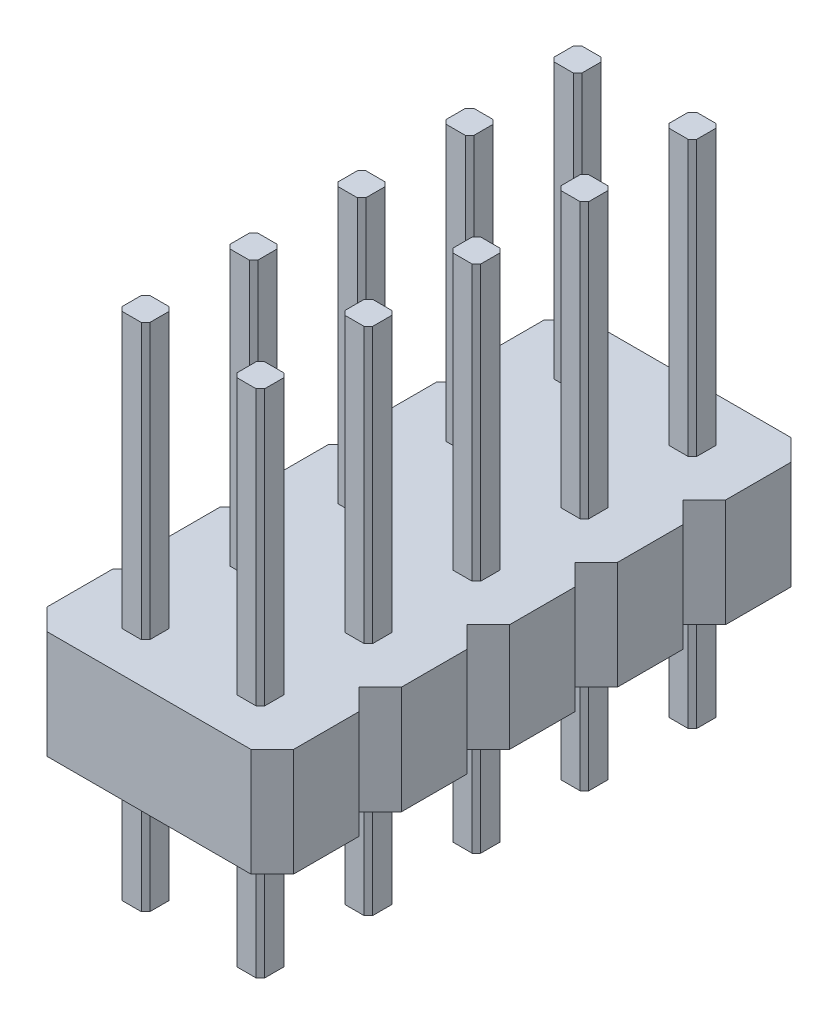
from build123d import *

# Parameters (mm, degrees)
BOSS_EXTRUDE2_DEPTH   = 12
BOSS_EXTRUDE2_2_DEPTH = 12
BOSS_EXTRUDE3_DEPTH   = 2.54
LPATTERN1_COUNT       = 5
LPATTERN1_PITCH       = 2.54
LPATTERN2_COUNT       = 5
LPATTERN2_PITCH       = 2.54


with BuildPart() as part:
    # Sketch1 → Boss-Extrude2 (new body)
    with BuildSketch(Plane(origin=(0, 0, 0), x_dir=(1, 0, 0), z_dir=(0, 1, 0))):
        Polygon((-0.325, 0.225), (-0.225, 0.325), (0.225, 0.325), (0.325, 0.225), (0.325, -0.225), (0.225, -0.325), (-0.225, -0.325), (-0.325, -0.225), align=None)
    boss_extrude2 = extrude(amount=BOSS_EXTRUDE2_DEPTH)



with BuildPart() as body_2:
    # Sketch1 → Boss-Extrude2 2 (new body)
    with BuildSketch(Plane(origin=(0, 0, 0), x_dir=(1, 0, 0), z_dir=(0, 1, 0))):
        Polygon((2.375, -0.225), (2.375, 0.225), (2.475, 0.325), (2.925, 0.325), (3.025, 0.225), (3.025, -0.225), (2.925, -0.325), (2.475, -0.325), align=None)
    boss_extrude2_2 = extrude(amount=BOSS_EXTRUDE2_2_DEPTH)


with BuildPart() as part_1:
    add(part.part)

    add(body_2.part)  # Boss-Extrude3 merges body 2
    # Sketch2 → Boss-Extrude3 (add)
    with BuildSketch(Plane(origin=(0, 3, 0), x_dir=(-1, 0, 0), z_dir=(0, -1, 0))):
        Polygon((-4.25, 0.77), (-3.75, 1.27), (1.05, 1.27), (1.55, 0.77), (1.55, -0.77), (1.05, -1.27), (-3.75, -1.27), (-4.25, -0.77), align=None)
    boss_extrude3 = extrude(amount=-BOSS_EXTRUDE3_DEPTH)

    # LPattern1: Boss-Extrude3 ×5
    with Locations(*[(0, 0, -i * LPATTERN1_PITCH) for i in range(1, LPATTERN1_COUNT)]):
        add(boss_extrude3)

    # LPattern2: Boss-Extrude2, Boss-Extrude2 2 ×5
    with Locations(*[(0, 0, -i * LPATTERN2_PITCH) for i in range(1, LPATTERN2_COUNT)]):
        add(boss_extrude2)
        add(boss_extrude2_2)


solid = part_1.part
